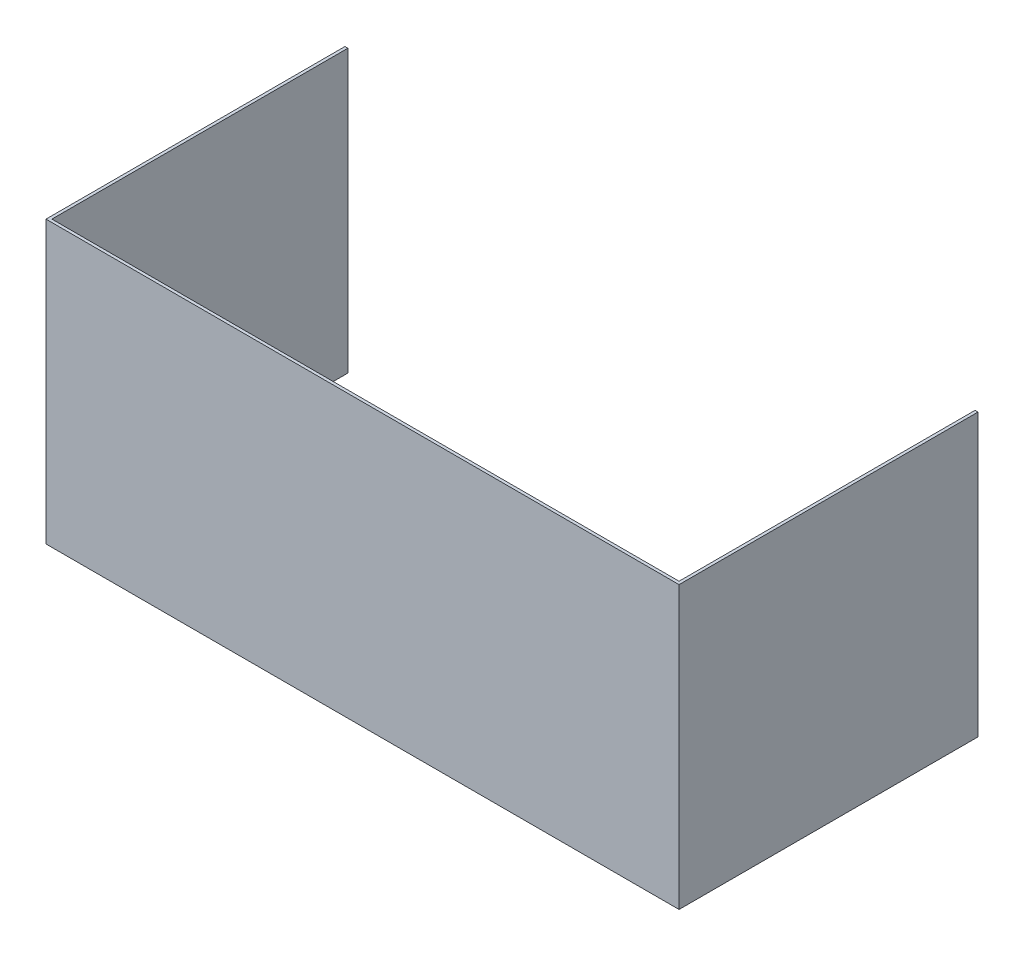
from build123d import *

# Parameters (mm, degrees)
EXTRUDE_THIN1_DEPTH = 304.8


with BuildPart() as part:
    # Sketch1 → Extrude-Thin1 (new body)
    with BuildSketch(Plane(origin=(0, 0, 0), x_dir=(1, 0, 0), z_dir=(0, 1, 0))):
        Polygon((-342.9, 196.85), (-342.9, -127), (-95.25, -127), (285.75, -127), (342.9, -127), (342.9, 196.85), (339.725, 196.85), (339.725, -123.825), (285.75, -123.825), (-95.25, -123.825), (-339.725, -123.825), (-339.725, 196.85), align=None)
    extrude(amount=EXTRUDE_THIN1_DEPTH)


solid = part.part
